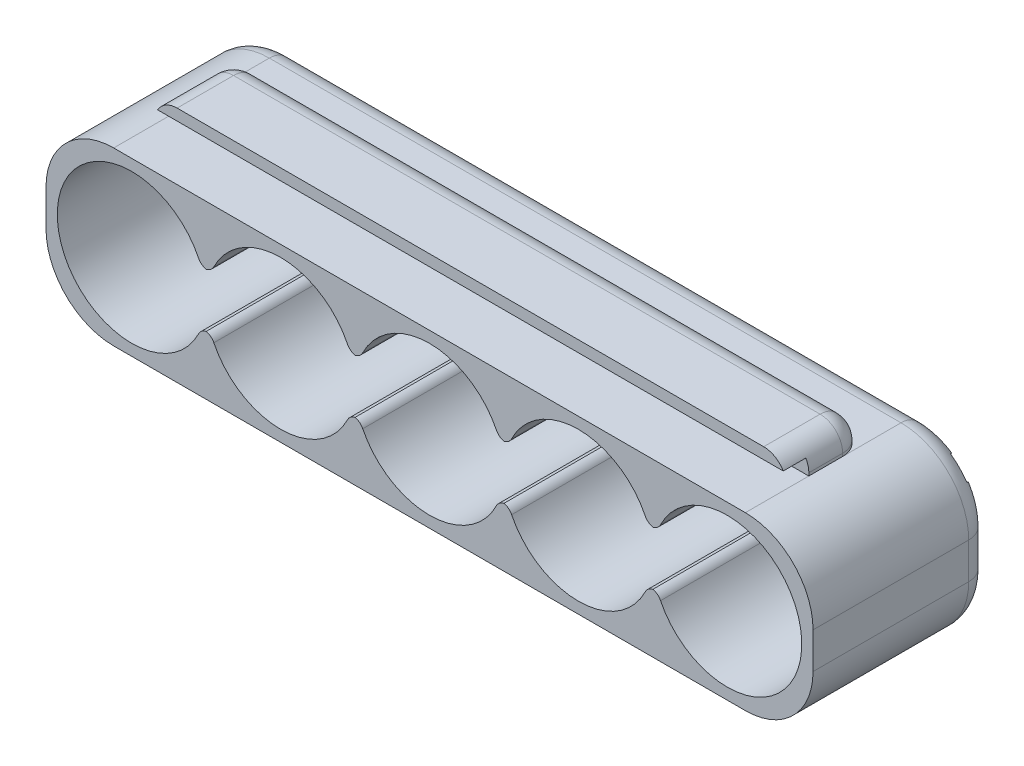
from build123d import *

# Parameters (mm, degrees)
BOSS_EXTRUDE1_DEPTH = 20
BOSS_EXTRUDE2_START = 0.8
SKETCH2_R           = 4
BOSS_EXTRUDE2_DEPTH = 0.8
FILLET1_R           = 1
BOSS_EXTRUDE5_DEPTH = 56
FILLET3_R           = 2
SKETCH5_W           = 52.8
SKETCH5_H           = 1
CUT_EXTRUDE1_DEPTH  = 0.8
CUT_EXTRUDE2_DEPTH  = 0.8
FILLET4_R           = 1


with BuildPart() as part:
    # Sketch1 → Boss-Extrude1 (new body)
    with BuildSketch(Plane.XY):
        with BuildLine():
            Line((-1.6, -7.6), (54.4, -7.6))
            ThreePointArc((54.4, -7.6), (58.642640687, -5.842640687), (60.4, -1.6))
            Line((60.4, -1.6), (60.4, 1.6))
            ThreePointArc((60.4, 1.6), (58.642640687, 5.842640687), (54.4, 7.6))
            Line((54.4, 7.6), (-1.6, 7.6))
            ThreePointArc((-1.6, 7.6), (-5.842640687, 5.842640687), (-7.6, 1.6))
            Line((-7.6, 1.6), (-7.6, -1.6))
            ThreePointArc((-7.6, -1.6), (-5.842640687, -5.842640687), (-1.6, -7.6))
        make_face()
        with BuildLine():
            Line((6.163635291, 2.36), (7.036364709, 2.36))
            ThreePointArc((7.036364709, 2.36), (13.2, 6.6), (19.363635291, 2.36))
            Line((19.363635291, 2.36), (20.236364709, 2.36))
            ThreePointArc((20.236364709, 2.36), (26.4, 6.6), (32.563635291, 2.36))
            Line((32.563635291, 2.36), (33.436364709, 2.36))
            ThreePointArc((33.436364709, 2.36), (39.6, 6.6), (45.763635291, 2.36))
            Line((45.763635291, 2.36), (46.636364709, 2.36))
            ThreePointArc((46.636364709, 2.36), (59.4, 0), (46.636364709, -2.36))
            Line((46.636364709, -2.36), (45.763635291, -2.36))
            ThreePointArc((45.763635291, -2.36), (39.6, -6.6), (33.436364709, -2.36))
            Line((33.436364709, -2.36), (32.563635291, -2.36))
            ThreePointArc((32.563635291, -2.36), (26.4, -6.6), (20.236364709, -2.36))
            Line((20.236364709, -2.36), (19.363635291, -2.36))
            ThreePointArc((19.363635291, -2.36), (13.2, -6.6), (7.036364709, -2.36))
            Line((7.036364709, -2.36), (6.163635291, -2.36))
            ThreePointArc((6.163635291, -2.36), (-6.6, 0), (6.163635291, 2.36))
        make_face(mode=Mode.SUBTRACT)
    extrude(amount=BOSS_EXTRUDE1_DEPTH)

    # Sketch2 → Boss-Extrude2 (add)
    with BuildSketch(Plane(origin=(0, 0, 0), x_dir=(-1, 0, 0), z_dir=(0, 0, -1)).offset(BOSS_EXTRUDE2_START)):
        with BuildLine():
            Line((-60.4, 1.6), (-60.4, -1.6))
            ThreePointArc((-60.4, -1.6), (-58.642640687, -5.842640687), (-54.4, -7.6))
            Line((-54.4, -7.6), (1.6, -7.6))
            ThreePointArc((1.6, -7.6), (5.842640687, -5.842640687), (7.6, -1.6))
            Line((7.6, -1.6), (7.6, 1.6))
            ThreePointArc((7.6, 1.6), (5.842640687, 5.842640687), (1.6, 7.6))
            Line((1.6, 7.6), (-54.4, 7.6))
            ThreePointArc((-54.4, 7.6), (-58.642640687, 5.842640687), (-60.4, 1.6))
        make_face()
        with Locations((-39.6, 0)):
            Circle(SKETCH2_R, mode=Mode.SUBTRACT)
        with Locations((-52.6, 0)):
            Circle(SKETCH2_R, mode=Mode.SUBTRACT)
        with Locations((-26.6, 0)):
            Circle(SKETCH2_R, mode=Mode.SUBTRACT)
        with Locations((-13.6, 0)):
            Circle(SKETCH2_R, mode=Mode.SUBTRACT)
        with Locations((-0.6, 0)):
            Circle(SKETCH2_R, mode=Mode.SUBTRACT)
    extrude(amount=-BOSS_EXTRUDE2_DEPTH)

    # Fillet1
    # the kernel refuses this fillet: 1 mm, written as the material it takes off along each edge
    with BuildSketch(Plane(origin=(19.363635291, 2.36, 0), x_dir=(-0.4002664400903543, 0.9163988088913009, 0), z_dir=(0, 0, 1)), Plane(origin=(32.563635291, 2.36, 0), x_dir=(-0.4002664400903529, 0.9163988088913013, 0), z_dir=(0, 0, 1)), Plane(origin=(33.436364709, -2.36, 0), x_dir=(0.4002664400903521, -0.9163988088913017, 0), z_dir=(0, 0, 1)), Plane(origin=(7.036364709, -2.36, 0), x_dir=(0.40026644009035284, -0.9163988088913013, 0), z_dir=(0, 0, 1)), Plane(origin=(6.163635291, 2.36, 0), x_dir=(-0.4002664400903531, 0.9163988088913012, 0), z_dir=(0, 0, 1)), Plane(origin=(46.636364709, -2.36, 0), x_dir=(0.40026644009034235, -0.916398808891306, 0), z_dir=(0, 0, 1)), Plane(origin=(45.763635291, 2.36, 0), x_dir=(-0.4002664400903545, 0.9163988088913007, 0), z_dir=(0, 0, 1))) as fillet1_piece_1:
        with BuildLine():
            CenterArc((0.654910814, -0.998935884), FILLET1_R, 92.643446555, 63.761717456)
            Line((-0.261487995, -0.598669444), (0, 0))
            ThreePointArc((0, 0), (0.304395167, -0.007023162), (0.608790334, 0))
        make_face()
    extrude(amount=21.633212087, mode=Mode.SUBTRACT)
    with BuildSketch(Plane(origin=(20.236364709, 2.36, 0), x_dir=(-1, 0, 0), z_dir=(0, 0, 1)), Plane(origin=(32.563635291, -2.36, 0), x_dir=(1, 0, 0), z_dir=(0, 0, 1)), Plane(origin=(19.363635291, -2.36, 0), x_dir=(1, 0, 0), z_dir=(0, 0, 1)), Plane(origin=(6.163635291, -2.36, 0), x_dir=(1, 0, 0), z_dir=(0, 0, 1)), Plane(origin=(7.036364709, 2.36, 0), x_dir=(-1, 0, 0), z_dir=(0, 0, 1)), Plane(origin=(45.763635291, -2.36, 0), x_dir=(1, 0, 0), z_dir=(0, 0, 1)), Plane(origin=(46.636364709, 2.36, 0), x_dir=(-1, 0, 0), z_dir=(0, 0, 1)), Plane(origin=(33.436364709, 2.36, 0), x_dir=(-1, 0, 0), z_dir=(0, 0, 1))) as fillet1_piece_2:
        with BuildLine():
            CenterArc((0.653284835, -1), FILLET1_R, 90, 63.761717456)
            ThreePointArc((-0.24367834, -0.557894737), (-0.115403152, -0.281758505), (0, 0))
            Line((0, 0), (0.653284835, 0))
        make_face()
    extrude(amount=21.633212087, mode=Mode.SUBTRACT)
    with BuildSketch(Plane(origin=(20.236364709, -2.36, 0), x_dir=(-1, 0, 0), z_dir=(0, 0, 1))) as fillet1_piece_3:
        with BuildLine():
            CenterArc((0.653284835, 1), FILLET1_R, 206.238282544, 63.761717456)
            ThreePointArc((-0.24367834, 0.557894737), (-0.115403152, 0.281758505), (0, 0))
            Line((0, 0), (0.653284835, 0))
        make_face()
    extrude(amount=21.633212087, mode=Mode.SUBTRACT)

    # Sketch4 → Boss-Extrude5 (add)
    with BuildSketch(Plane(origin=(54.4, 0, 0), x_dir=(0, 0, -1), z_dir=(1, 0, 0))):
        with BuildLine():
            Line((-9.375, 8.85), (-9.375, 7.6))
            Line((-9.375, 7.6), (-4.375, 7.6))
            Line((-4.375, 7.6), (-4.375, 7.85))
            ThreePointArc((-4.375, 7.85), (-4.960786438, 9.264213562), (-6.375, 9.85))
            Line((-6.375, 9.85), (-11.375, 9.85))
            Line((-11.375, 9.85), (-11.375, 8.85))
            Line((-11.375, 8.85), (-9.375, 8.85))
        make_face()
    extrude(amount=-BOSS_EXTRUDE5_DEPTH)

    # Fillet3
    fillet3_edges = [part.edges().sort_by_distance(p)[0] for p in [
        (54.4, 7.725, 4.375),
        (54.4, 9.85, 8.875),
        (-1.6, 7.725, 4.375),
        (-1.6, 9.85, 8.875),
        (26.4, 7.6, -0.8),
        (58.642640687, 5.842640687, -0.8),
        (60.4, 0, -0.8),
        (58.642640687, -5.842640687, -0.8),
        (26.4, -7.6, -0.8),
        (-5.842640687, -5.842640687, -0.8),
        (-7.6, 0, -0.8),
        (-5.842640687, 5.842640687, -0.8),
        (54.4, 9.264213562, 4.960786438),
        (-1.6, 9.264213562, 4.960786438),
    ]]
    fillet(fillet3_edges, radius=FILLET3_R)

    # SurfaceCut1
    split(bisect_by=Plane.XY.offset(15), keep=Keep.BOTTOM)

    # Sketch5 → Cut-Extrude1 (cut)
    with BuildSketch(Plane(origin=(0, 0, -0.8), x_dir=(-1, 0, 0), z_dir=(0, 0, -1))):
        with Locations((-26.4, 0)):
            Rectangle(SKETCH5_W, SKETCH5_H)
    extrude(amount=-CUT_EXTRUDE1_DEPTH, mode=Mode.SUBTRACT)

    # Sketch6 → Cut-Extrude2 (cut)
    with BuildSketch(Plane(origin=(0, 0, -0.8), x_dir=(-1, 0, 0), z_dir=(0, 0, -1))):
        Polygon((-51.882408418, 0.75), (-53.317591582, -0.75), (-59.391344495, 5.061298617), (-57.956161331, 6.561298617), align=None)
        Polygon((0.517591582, -0.75), (6.591344495, 5.061298617), (5.156161331, 6.561298617), (-0.917591582, 0.75), align=None)
    extrude(amount=-CUT_EXTRUDE2_DEPTH, mode=Mode.SUBTRACT)

    # Fillet4
    # the kernel refuses this fillet: 1 mm, written as the material it takes off along each edge
    with BuildSketch(Plane(origin=(48.631373033, -0.5, 2.002672601), x_dir=(0.21335743505986599, -0.9769742089250233, 0), z_dir=(0, 0, -1)), Plane(origin=(22.631373033, -0.5, 2.002672601), x_dir=(0.21335743505992955, -0.9769742089250094, 0), z_dir=(0, 0, -1)), Plane(origin=(9.631373033, -0.5, 2.002672601), x_dir=(0.2133574350599274, -0.97697420892501, 0), z_dir=(0, 0, -1)), Plane(origin=(35.631373033, -0.5, 2.002672601), x_dir=(0.21335743505992988, -0.9769742089250093, 0), z_dir=(0, 0, -1)), Plane(origin=(30.568626967, 0.5, 2.002672601), x_dir=(-0.21335743505992477, 0.9769742089250104, 0), z_dir=(0, 0, -1)), Plane(origin=(17.568626967, 0.5, 2.002672601), x_dir=(-0.21335743505992952, 0.9769742089250095, 0), z_dir=(0, 0, -1)), Plane(origin=(4.568626967, 0.5, 2.002672601), x_dir=(-0.2133574350599261, 0.9769742089250103, 0), z_dir=(0, 0, -1)), Plane(origin=(43.568626967, 0.5, 2.002672601), x_dir=(-0.21335743505991978, 0.9769742089250115, 0), z_dir=(0, 0, -1))) as fillet4_piece_1:
        with BuildLine():
            CenterArc((0.806060173, 0.995981227), FILLET4_R, 192.319179453, 72.542396876)
            Line((-0.170914036, 0.782623792), (0, 0))
            ThreePointArc((0, 0), (0.358248966, 0.016075091), (0.716497932, 0))
        make_face()
    extrude(amount=4.805345202, mode=Mode.SUBTRACT)
    with BuildSketch(Plane(origin=(30.568626967, -0.5, 2.002672601), x_dir=(1, 0, 0), z_dir=(0, 0, -1)), Plane(origin=(17.568626967, -0.5, 2.002672601), x_dir=(1, 0, 0), z_dir=(0, 0, -1)), Plane(origin=(4.568626967, -0.5, 2.002672601), x_dir=(1, 0, 0), z_dir=(0, 0, -1)), Plane(origin=(43.568626967, -0.5, 2.002672601), x_dir=(1, 0, 0), z_dir=(0, 0, -1)), Plane(origin=(48.631373033, 0.5, 2.002672601), x_dir=(-1, 0, 0), z_dir=(0, 0, -1)), Plane(origin=(22.631373033, 0.5, 2.002672601), x_dir=(-1, 0, 0), z_dir=(0, 0, -1)), Plane(origin=(9.631373033, 0.5, 2.002672601), x_dir=(-1, 0, 0), z_dir=(0, 0, -1)), Plane(origin=(35.631373033, 0.5, 2.002672601), x_dir=(-1, 0, 0), z_dir=(0, 0, -1))) as fillet4_piece_2:
        with BuildLine():
            CenterArc((0.80106904, 1), FILLET4_R, 197.457603124, 72.542396876)
            ThreePointArc((-0.152870161, 0.7), (-0.060730131, 0.35342974), (0, 0))
            Line((0, 0), (0.80106904, 0))
        make_face()
    extrude(amount=4.805345202, mode=Mode.SUBTRACT)
    with BuildSketch(Plane(origin=(54.673582248, 3.420563793, 1.757077492), x_dir=(-0.8932317154031736, 0.44959659985136, 0), z_dir=(0, 0, -1))) as fillet4_piece_3:
        with BuildLine():
            CenterArc((0.707210049, 0.996907898), FILLET4_R, 199.547236038, 65.945878752)
            Line((-0.235155924, 0.662324016), (0, 0))
            ThreePointArc((0, 0), (0.314315577, 0.012368407), (0.628631154, 0))
        make_face()
    extrude(amount=4.314154985, mode=Mode.SUBTRACT)
    with BuildSketch(Plane(origin=(56.108765412, 1.920563793, 1.757077492), x_dir=(0.7225454721199355, 0.6913233980699479, 0), z_dir=(0, 0, -1))) as fillet4_piece_4:
        with BuildLine():
            CenterArc((0.702830997, 1), FILLET4_R, 204.054121248, 65.945878752)
            ThreePointArc((-0.210329852, 0.592400609), (-0.09350936, 0.300338574), (0, 0))
            Line((0, 0), (0.702830997, 0))
        make_face()
    extrude(amount=4.314154985, mode=Mode.SUBTRACT)
    with BuildSketch(Plane(origin=(52.8, 0, 0), x_dir=(0.24692391813738693, 0.9690348696779084, 0), z_dir=(-0.9690348696779084, 0.24692391813738693, 0))) as fillet4_piece_5_section:
        with BuildLine():
            CenterArc((6.6 + FILLET4_R, -FILLET4_R), FILLET4_R, 90, 90)
            Line((6.6 + FILLET4_R, 0), (6.6, 0))
            Line((6.6, 0), (6.6, -FILLET4_R))
        make_face()
    fillet4_piece_5 = revolve(axis=Axis((52.8, 0, 0), (0, 0, -1)), revolution_arc=61.507914383, mode=Mode.PRIVATE)
    fillet4_piece_5 = split(fillet4_piece_5, bisect_by=Plane(origin=(58.331972384, 4.047703271, 0.223392929), z_dir=(-0.6913233980699469, 0.7225454721199365, 0)), keep=Keep.TOP, mode=Mode.PRIVATE)
    fillet4_piece_5 = split(fillet4_piece_5, bisect_by=Plane(origin=(56.896789219, 5.547703271, 0.223392929), z_dir=(0.6913233980699485, -0.722545472119935, 0)), keep=Keep.TOP, mode=Mode.PRIVATE)
    add(fillet4_piece_5, mode=Mode.SUBTRACT)
    with BuildSketch(Plane(origin=(-1.71090881, 3.264919673, 1.881489403), x_dir=(-0.7225454721199359, 0.6913233980699474, 0), z_dir=(0, 0, -1))) as fillet4_piece_6:
        with BuildLine():
            CenterArc((0.752595761, 1), FILLET4_R, 200.627661316, 69.372338684)
            ThreePointArc((-0.183293803, 0.647706481), (-0.077997746, 0.327715801), (0, 0))
            Line((0, 0), (0.752595761, 0))
        make_face()
    extrude(amount=4.562978805, mode=Mode.SUBTRACT)
    with BuildSketch(Plane(origin=(-3.038418773, 1.661899163, 1.635515036), x_dir=(-0.7225454721199365, 0.6913233980699467, 0), z_dir=(0, 0, -1))) as fillet4_piece_7:
        with BuildLine():
            CenterArc((0.654206014, -1), FILLET4_R, 90, 62.425261714)
            ThreePointArc((-0.232201746, -0.537094737), (-0.106266595, -0.272799014), (0, 0))
            Line((0, 0), (0.654206014, 0))
        make_face()
    extrude(amount=4.071030072, mode=Mode.SUBTRACT)
    with BuildSketch(Plane(origin=(0, 0, 0), x_dir=(-0.9694602228338824, 0.24524860110279717, 0), z_dir=(-0.24524860110279717, -0.9694602228338824, 0))) as fillet4_piece_8_section:
        with BuildLine():
            CenterArc((6.6 + FILLET4_R, -FILLET4_R), FILLET4_R, 90, 90)
            Line((6.6 + FILLET4_R, 0), (6.6, 0))
            Line((6.6, 0), (6.6, -FILLET4_R))
        make_face()
    fillet4_piece_8 = revolve(axis=Axis((0, 0, 0), (0, 0, -1)), revolution_arc=61.507914383, mode=Mode.PRIVATE)
    fillet4_piece_8 = split(fillet4_piece_8, bisect_by=Plane(origin=(-4.096789218, 5.54770327, 0.22339293), z_dir=(-0.6913233980699475, -0.7225454721199359, 0)), keep=Keep.TOP, mode=Mode.PRIVATE)
    fillet4_piece_8 = split(fillet4_piece_8, bisect_by=Plane(origin=(-5.531972383, 4.04770327, 0.22339293), z_dir=(0.6913233980699468, 0.7225454721199366, 0)), keep=Keep.TOP, mode=Mode.PRIVATE)
    add(fillet4_piece_8, mode=Mode.SUBTRACT)


solid = part.part
